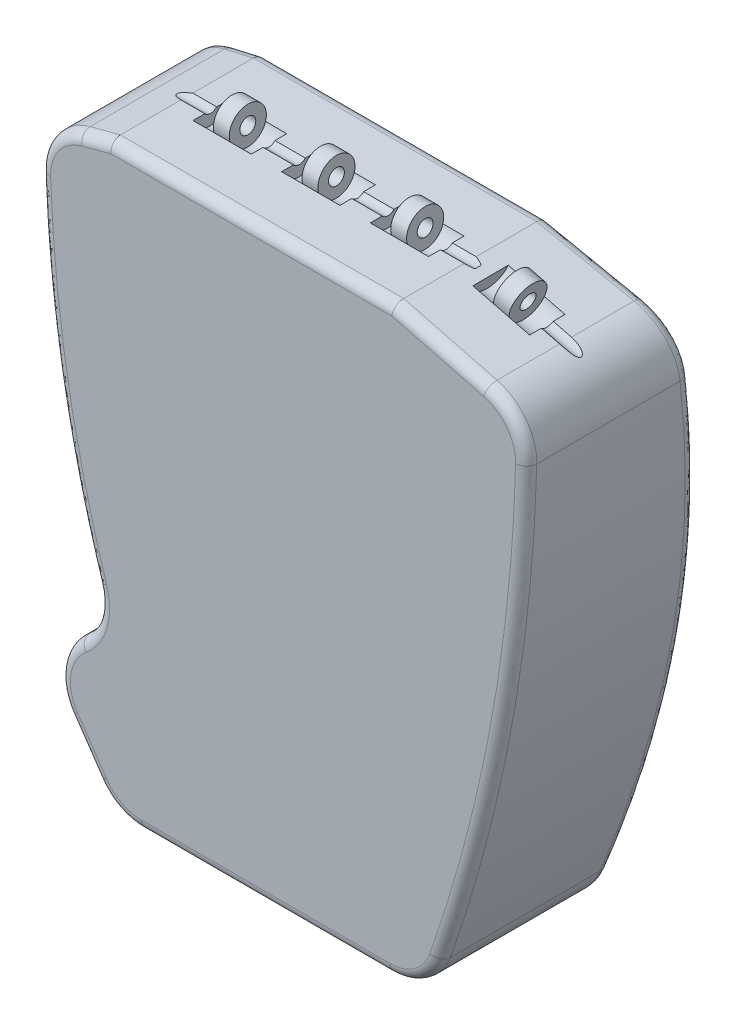
from build123d import *

# Parameters (mm, degrees)
SKETCH1_W                = 92
SKETCH1_H                = 110
BOSS_EXTRUDE1_DEPTH      = 20
CUT_EXTRUDE1_DEPTH       = 149.875787152
CUT_EXTRUDE1_DEPTH_BACK  = 149.875787152
FILLET1_R                = 10
CUT_EXTRUDE2_DEPTH       = 145.724640789
CUT_EXTRUDE2_DEPTH_BACK  = 145.724640789
FILLET2_R                = 2
SKETCH16_R               = 3.5
BOSS_EXTRUDE3_DEPTH      = 1.5
CUT_EXTRUDE4_START       = 4
SKETCH17_R               = 3.5
CUT_EXTRUDE4_DEPTH       = 4
CUT_EXTRUDE5_DEPTH       = 135.22149501
CUT_EXTRUDE5_DEPTH_BACK  = 4
SKETCH18_R               = 1.5
SKETCH20_R               = 3.5
BOSS_EXTRUDE4_DEPTH      = 1.5
CUT_EXTRUDE6_START       = 4
SKETCH21_R               = 3.5
CUT_EXTRUDE6_DEPTH       = 4
MIRROR4_START            = 4
MIRROR4_COPY_1_SKETCH_R  = 3.5
MIRROR4_COPY_1_DEPTH     = 4
MIRROR5_START            = 4
MIRROR5_COPY_1_SKETCH_R  = 3.5
MIRROR5_COPY_1_DEPTH     = 4
SKETCH23_R               = 1.5
CUT_EXTRUDE8_DEPTH       = 127.673583587
CUT_EXTRUDE9_DEPTH       = 10
CUT_EXTRUDE9_DEPTH_BACK  = 130.967109786
SKETCH22_R               = 1.5
SKETCH25_R               = 3.5
BOSS_EXTRUDE6_DEPTH      = 1.5
SKETCH26_R               = 3.499589234
CUT_EXTRUDE11_DEPTH      = 4
CUT_EXTRUDE12_DEPTH      = 10
CUT_EXTRUDE12_DEPTH_BACK = 7
SKETCH27_R               = 1.5
SKETCH28_R               = 10.5
CUT_EXTRUDE13_DEPTH      = 2.5


with BuildPart() as part:
    # Sketch1 → Boss-Extrude1 (new, symmetric)
    with BuildSketch(Plane.XY):
        with Locations((46, 55)):
            Rectangle(SKETCH1_W, SKETCH1_H)
    extrude(amount=BOSS_EXTRUDE1_DEPTH, both=True)

    # Sketch2 → Cut-Extrude1 (cut, two sides: drawn at the far end of the back side and taken through both)
    with BuildSketch(Plane.XY.offset(20).offset(-CUT_EXTRUDE1_DEPTH_BACK)):
        Polygon((0, 110), (0, 106.5), (13.309574973, 110), align=None)
        with BuildLine():
            add(Edge.make_bspline(
                [(0, 106.5), (0, 82.602122917), (3.597790542, 59.195902149), (10.800312418, 36.500886015)],
                knots=[0, 0, 0, 0, 0.906287859, 0.906287859, 0.906287859, 0.906287859], degree=3))
            Line((0, 106.5), (0, 20.5))
            Line((0, 20.5), (6.908414311, 25.217941481))
            ThreePointArc((6.908414311, 25.217941481), (10.722210647, 30.215125257), (10.800312418, 36.500886015))
        make_face()
        Polygon((14, 0), (0, 20.5), (0, 0), align=None)
        Polygon((92, 110), (66.778003096, 110), (92, 103.5), align=None)
        with BuildLine():
            add(Edge.make_bspline(
                [(92, 103.5), (92, 50.031264704), (73.162473305, 0)],
                knots=[0, 0, 0, 1, 1, 1], degree=2))
            Line((73.162473305, 0), (92, 0))
            Line((92, 0), (92, 103.5))
        make_face()
    extrude(amount=CUT_EXTRUDE1_DEPTH + CUT_EXTRUDE1_DEPTH_BACK, mode=Mode.SUBTRACT)

    # Fillet1
    fillet1_edges = [part.edges().sort_by_distance(p)[0] for p in [
        (92, 103.5, 0),
        (73.162473305, 0, 0),
        (0, 20.5, 0),
        (14, 0, 0),
        (0, 106.5, 0),
    ]]
    fillet(fillet1_edges, radius=FILLET1_R)

    # Sketch3 → Cut-Extrude2 (cut, two sides: drawn at the far end of the back side and taken through both)
    with BuildSketch(Plane(origin=(0, 0, 0), x_dir=(0, 0, -1), z_dir=(1, 0, 0)).offset(-CUT_EXTRUDE2_DEPTH_BACK)):
        with BuildLine():
            Line((7.772742956, 115.443303774), (22.500045398, 115.443303774))
            Line((22.500045398, 115.443303774), (22.500045398, -6.875124845))
            Line((22.500045398, -6.875124845), (10.43183923, -6.875124845))
            add(Edge.make_bspline(
                [(7.772742956, 115.443303774), (19.55640098, 54.518608073), (10.43183923, -6.875124845)],
                knots=[0, 0, 0, 1, 1, 1], degree=2))
        make_face()
    extrude(amount=CUT_EXTRUDE2_DEPTH + CUT_EXTRUDE2_DEPTH_BACK, mode=Mode.SUBTRACT)

    # Fillet2
    fillet2_edges = [part.edges().sort_by_distance(p)[0] for p in [
        (2.096525335, 104.779212328, -9.674588803),
        (42.717828064, 0, -11.388286469),
        (40.043789034, 110, -8.783659787),
        (71.951230581, 1.850819048, -11.623423213),
        (87.220095512, 50.504642819, -14.392832698),
        (89.893085383, 101.783089569, -10.151124254),
        (75.585431518, 107.73022394, -9.180456898),
        (10.448111437, 109.247525004, -8.916818573),
        (3.325433071, 67.20411945, -13.821673338),
        (10.847443127, 30.603747446, -14.056071901),
        (3.964429443, 19.378900711, -13.379562038),
        (8.313111413, 8.327229717, -12.371533032),
        (14.605192876, 1.160066134, -11.536775901),
        (40.043789034, 110, 20),
        (3.338768341, 67.126484785, 20),
        (75.58573273, 107.730146315, 20),
        (87.213460534, 50.468479823, 20),
        (8.312036729, 8.328803361, 20),
        (42.717828064, 0, 20),
        (10.4480769, 109.247515922, 20),
        (10.847643432, 30.604415595, 20),
        (2.108120664, 104.794821654, 20),
        (14.610934545, 1.157032042, 20),
        (3.965310104, 19.384930966, 20),
        (71.942735953, 1.844784264, 20),
        (89.88265676, 101.796946216, 20),
    ]]
    fillet(fillet2_edges, radius=FILLET2_R)

    # Sketch16 → Boss-Extrude3 (add, symmetric)
    with BuildSketch(Plane(origin=(44.876341708, -11.565151729, -0.214324723), x_dir=(-0.004478409836417424, 0.001154137955338559, -0.9999893058482762), z_dir=(0.9683496126241796, -0.24955488282443708, -0.004624736650110296))):
        with Locations((-5.330234846, 124.184551481)):
            Circle(SKETCH16_R)
    extrude(amount=BOSS_EXTRUDE3_DEPTH, both=True)

    # Sketch17 → Cut-Extrude4 (cut)
    with BuildSketch(Plane(origin=(46.328866126, -11.939484053, -0.221261828), x_dir=(-0.004478409836417424, 0.0011541379553385597, -0.9999893058482762), z_dir=(0.9683496126241796, -0.24955488282443714, -0.004624736650110297)).offset(CUT_EXTRUDE4_START)):
        with Locations((-5.330234846, 124.184551481)):
            Circle(SKETCH17_R)
    cut_extrude4 = extrude(amount=-CUT_EXTRUDE4_DEPTH, mode=Mode.SUBTRACT)

    # Mirror2: Cut-Extrude4 across plane
    add(cut_extrude4.mirror(Plane(origin=(44.876341708, -11.565151729, -0.214324723), x_dir=(0.004478409836417424, -0.0011541379553385595, 0.9999893058482762), z_dir=(0.9683496126241796, -0.24955488282443708, -0.004624736650110296))), mode=Mode.SUBTRACT)

    # Sketch18 → Cut-Extrude5 (cut, two sides: drawn at the far end of the back side and taken through both)
    with BuildSketch(Plane(origin=(46.328866126, -11.939484053, -0.221261828), x_dir=(-0.004478409836417424, 0.0011541379553385597, -0.9999893058482762), z_dir=(0.9683496126241796, -0.24955488282443714, -0.004624736650110297)).offset(-CUT_EXTRUDE5_DEPTH_BACK)):
        with Locations(Location((-5.330234846, 124.184551481, 0), (0, 0, 90))):
            Circle(SKETCH18_R)
    extrude(amount=CUT_EXTRUDE5_DEPTH + CUT_EXTRUDE5_DEPTH_BACK, mode=Mode.SUBTRACT)

    # Sketch20 → Boss-Extrude4 (add, symmetric)
    with BuildSketch(Plane(origin=(56.777882555, 0, 0), x_dir=(0, 0, -1), z_dir=(1, 0, 0))):
        with Locations((-5.453288161, 111)):
            Circle(SKETCH20_R)
    boss_extrude4 = extrude(amount=BOSS_EXTRUDE4_DEPTH, both=True)

    # Sketch21 → Cut-Extrude6 (cut)
    with BuildSketch(Plane(origin=(58.277882555, 0, 0), x_dir=(0, 0, -1), z_dir=(1, 0, 0)).offset(CUT_EXTRUDE6_START)):
        with Locations((-5.453288161, 111)):
            Circle(SKETCH21_R)
    cut_extrude6 = extrude(amount=-CUT_EXTRUDE6_DEPTH, mode=Mode.SUBTRACT)

    # Mirror3: Cut-Extrude6 across plane
    add(cut_extrude6.mirror(Plane(origin=(56.777882555, 0, 0), x_dir=(0, 0, 1), z_dir=(1, 0, 0))), mode=Mode.SUBTRACT)

    # Mirror4: Boss-Extrude4, Cut-Extrude6 across plane
    add(boss_extrude4.mirror(Plane(origin=(40.043792633, 0, 0), x_dir=(0, 0, 1), z_dir=(1, 0, 0))))
    add(cut_extrude6.mirror(Plane(origin=(40.043792633, 0, 0), x_dir=(0, 0, 1), z_dir=(1, 0, 0))), mode=Mode.SUBTRACT)

    # Mirror4 copy 1 sketch → Mirror4 copy 1 (cut)
    with BuildSketch(Plane(origin=(24.809702711, 0, 0), x_dir=(0, 0, -1), z_dir=(1, 0, 0)).offset(MIRROR4_START)):
        with Locations((-5.453288161, 111)):
            Circle(MIRROR4_COPY_1_SKETCH_R)
    extrude(amount=-MIRROR4_COPY_1_DEPTH, mode=Mode.SUBTRACT)

    # Mirror5: Boss-Extrude4, Cut-Extrude6 across plane
    add(boss_extrude4.mirror(Plane(origin=(48.408792633, 0, 0), x_dir=(0, 0, 1), z_dir=(1, 0, 0))))
    add(cut_extrude6.mirror(Plane(origin=(48.408792633, 0, 0), x_dir=(0, 0, 1), z_dir=(1, 0, 0))), mode=Mode.SUBTRACT)

    # Mirror5 copy 1 sketch → Mirror5 copy 1 (cut)
    with BuildSketch(Plane(origin=(41.539702711, 0, 0), x_dir=(0, 0, -1), z_dir=(1, 0, 0)).offset(MIRROR5_START)):
        with Locations((-5.453288161, 111)):
            Circle(MIRROR5_COPY_1_SKETCH_R)
    extrude(amount=-MIRROR5_COPY_1_DEPTH, mode=Mode.SUBTRACT)

    # Sketch23 → Cut-Extrude8 (cut, through all)
    with BuildSketch(Plane(origin=(41.539702711, 0, 0), x_dir=(0, 0, -1), z_dir=(1, 0, 0))):
        with Locations((-5.453288161, 111)):
            Circle(SKETCH23_R)
    extrude(amount=-CUT_EXTRUDE8_DEPTH, mode=Mode.SUBTRACT)

    # Sketch22 → Cut-Extrude9 (cut, two sides: drawn at the far end of the back side and taken through both)
    with BuildSketch(Plane(origin=(58.277882555, 0, 0), x_dir=(0, 0, -1), z_dir=(1, 0, 0)).offset(-CUT_EXTRUDE9_DEPTH_BACK)):
        with Locations((-5.453288161, 111)):
            Circle(SKETCH22_R)
    extrude(amount=CUT_EXTRUDE9_DEPTH + CUT_EXTRUDE9_DEPTH_BACK, mode=Mode.SUBTRACT)

    # Sketch25 → Boss-Extrude6 (add, symmetric)
    with BuildSketch(Plane(origin=(10.569036804, 30.705230104, 0.008388854), x_dir=(0.9455529068739298, -0.32546841996652554, -8.891993548564661e-05), z_dir=(0.3254684321132566, 0.9455528715851711, 0.0002583307478749207))):
        with Locations((-0.69725008, -5.423235295)):
            Circle(SKETCH25_R)
    extrude(amount=BOSS_EXTRUDE6_DEPTH, both=True)

    # Sketch26 → Cut-Extrude11 (cut)
    with BuildSketch(Plane(origin=(10.080834156, 29.286900797, 0.008001358), x_dir=(0.9455529068739298, -0.32546841996652554, -8.891993548564662e-05), z_dir=(-0.3254684321132566, -0.9455528715851712, -0.0002583307478749207))):
        with Locations((-1.19725008, 5.422824533)):
            Circle(SKETCH26_R)
    cut_extrude11 = extrude(amount=CUT_EXTRUDE11_DEPTH, mode=Mode.SUBTRACT)

    # Mirror6: Cut-Extrude11 across plane
    add(cut_extrude11.mirror(Plane(origin=(10.569036804, 30.705230104, 0.008388854), x_dir=(-8.407850628297563e-05, -0.0002442653886223742, 0.9999999666326118), z_dir=(0.32546843211325666, 0.9455528715851712, 0.00025833074787492077))), mode=Mode.SUBTRACT)

    # Sketch27 → Cut-Extrude12 (cut, two sides: drawn at the far end of the back side and taken through both)
    with BuildSketch(Plane(origin=(10.080834156, 29.286900797, 0.008001358), x_dir=(0.9455529068739298, -0.32546841996652554, -8.891993548564662e-05), z_dir=(-0.3254684321132566, -0.9455528715851712, -0.0002583307478749207)).offset(-CUT_EXTRUDE12_DEPTH_BACK)):
        with Locations(Location((-0.69725008, 5.423235295, 0), (0, 0, 249.829091614))):
            Circle(SKETCH27_R)
    extrude(amount=CUT_EXTRUDE12_DEPTH + CUT_EXTRUDE12_DEPTH_BACK, mode=Mode.SUBTRACT)

    # Sketch28 → Cut-Extrude13 (cut)
    with BuildSketch(Plane.XZ):
        with Locations(Location((42.717828064, 3.216490395, 0), (0, 0, 270))):
            Circle(SKETCH28_R)
    extrude(amount=-CUT_EXTRUDE13_DEPTH, mode=Mode.SUBTRACT)


solid = part.part
